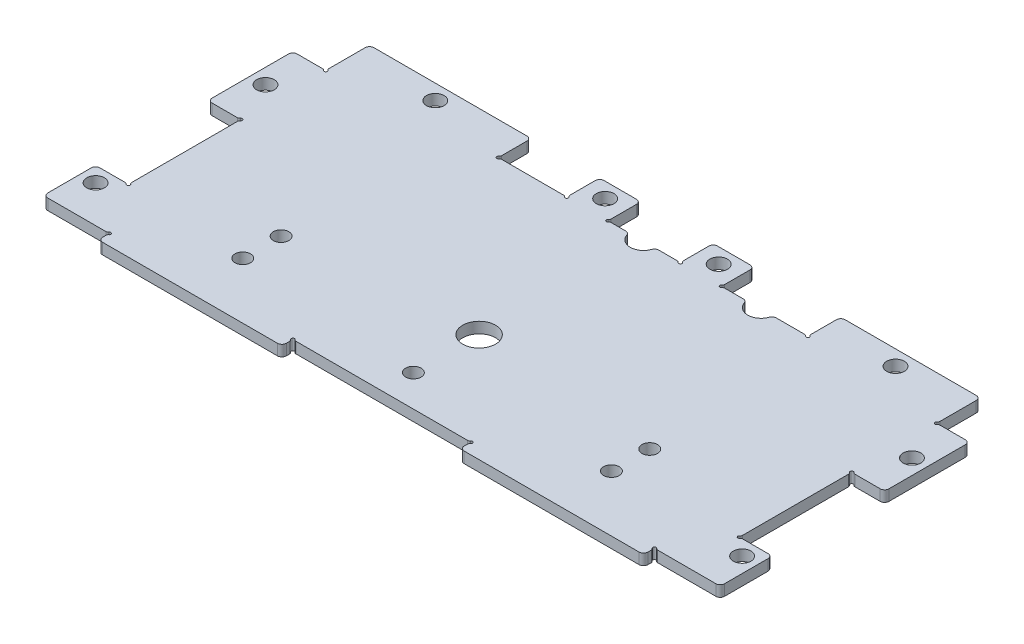
from build123d import *

# Parameters (mm, degrees)
STOCK_HAMMERSAW_START                   = 50.8
STOCK_HAMMERSAW_MULTIBODY_1_OUTLINE_R   = 2.5527
STOCK_HAMMERSAW_MULTIBODY_1_OUTLINE_R_2 = 2.2479
STOCK_HAMMERSAW_MULTIBODY_1_OUTLINE_R_3 = 4.7625
STOCK_HAMMERSAW_MULTIBODY_1_DEPTH       = 3.175
CUT_EXTRUDE1_DEPTH                      = 119.924837082
SKETCH2_R                               = 0.47625
CUT_EXTRUDE2_DEPTH                      = 119.395950087
FILLET1_R                               = 0.635
FILLET2_R                               = 1.27


# Read off the part's stored shape, not the designer's step: Stock-HammerSaw Multibody-1
with BuildPart() as part:
    # Stock-HammerSaw Multibody-1 outline → Stock-HammerSaw Multibody-1 (new body)
    with BuildSketch(Plane(origin=(0, 0, 0), x_dir=(1, 0, 0), z_dir=(0, 1, 0)).offset(STOCK_HAMMERSAW_START)):
        with BuildLine():
            Line((47.625, 57.15), (37.846, 57.15))
            ThreePointArc((37.846, 57.15), (34.036, 53.34), (30.226, 57.15))
            Line((30.226, 57.15), (23.368, 57.15))
            Line((23.368, 57.15), (23.368, 66.675))
            Line((23.368, 66.675), (10.668, 66.675))
            Line((10.668, 66.675), (10.668, 57.15))
            Line((10.668, 57.15), (3.81, 57.15))
            ThreePointArc((3.81, 57.15), (0, 53.34), (-3.81, 57.15))
            Line((-3.81, 57.15), (-9.525, 57.15))
            Line((-9.525, 57.15), (-9.525, 66.675))
            Line((-9.525, 66.675), (-22.225, 66.675))
            Line((-22.225, 66.675), (-22.225, 57.15))
            Line((-22.225, 57.15), (-41.275, 57.15))
            Line((-41.275, 57.15), (-41.275, 66.675))
            Line((-41.275, 66.675), (-88.9, 66.675))
            Line((-88.9, 66.675), (-88.9, 53.975))
            Line((-88.9, 53.975), (-98.425, 53.975))
            Line((-98.425, 53.975), (-98.425, 28.575))
            Line((-98.425, 28.575), (-88.9, 28.575))
            Line((-88.9, 28.575), (-88.9, -3.175))
            Line((-88.9, -3.175), (-98.425, -3.175))
            Line((-98.425, -3.175), (-98.425, -19.05))
            Line((-98.425, -19.05), (-79.375, -19.05))
            Line((-79.375, -19.05), (-79.375, -22.225))
            Line((-79.375, -22.225), (-25.4, -22.225))
            Line((-25.4, -22.225), (-25.4, -19.05))
            Line((-25.4, -19.05), (25.4, -19.05))
            Line((25.4, -19.05), (25.4, -22.225))
            Line((25.4, -22.225), (79.375, -22.225))
            Line((79.375, -22.225), (79.375, -19.05))
            Line((79.375, -19.05), (98.425, -19.05))
            Line((98.425, -19.05), (98.425, -3.175))
            Line((98.425, -3.175), (88.9, -3.175))
            Line((88.9, -3.175), (88.9, 28.575))
            Line((88.9, 28.575), (98.425, 28.575))
            Line((98.425, 28.575), (98.425, 53.975))
            Line((98.425, 53.975), (88.9, 53.975))
            Line((88.9, 53.975), (88.9, 66.675))
            Line((88.9, 66.675), (47.625, 66.675))
            Line((47.625, 66.675), (47.625, 57.15))
        make_face()
        with Locations((-93.6625, -7.9375)):
            Circle(STOCK_HAMMERSAW_MULTIBODY_1_OUTLINE_R, mode=Mode.SUBTRACT)
        with Locations((-53.4035, -5.55244)):
            Circle(STOCK_HAMMERSAW_MULTIBODY_1_OUTLINE_R_2, mode=Mode.SUBTRACT)
        with Locations((-53.4035, 5.55244)):
            Circle(STOCK_HAMMERSAW_MULTIBODY_1_OUTLINE_R_2, mode=Mode.SUBTRACT)
        with Locations((0, -9.525)):
            Circle(STOCK_HAMMERSAW_MULTIBODY_1_OUTLINE_R_2, mode=Mode.SUBTRACT)
        with Locations((53.4035, -5.55244)):
            Circle(STOCK_HAMMERSAW_MULTIBODY_1_OUTLINE_R_2, mode=Mode.SUBTRACT)
        with Locations((93.6625, -7.9375)):
            Circle(STOCK_HAMMERSAW_MULTIBODY_1_OUTLINE_R, mode=Mode.SUBTRACT)
        with Locations((0, 9.525)):
            Circle(STOCK_HAMMERSAW_MULTIBODY_1_OUTLINE_R_3, mode=Mode.SUBTRACT)
        with Locations((53.4035, 5.55244)):
            Circle(STOCK_HAMMERSAW_MULTIBODY_1_OUTLINE_R_2, mode=Mode.SUBTRACT)
        with Locations((-93.6625, 41.275)):
            Circle(STOCK_HAMMERSAW_MULTIBODY_1_OUTLINE_R, mode=Mode.SUBTRACT)
        with Locations((-65.0875, 61.9125)):
            Circle(STOCK_HAMMERSAW_MULTIBODY_1_OUTLINE_R, mode=Mode.SUBTRACT)
        with Locations((-15.875, 61.9125)):
            Circle(STOCK_HAMMERSAW_MULTIBODY_1_OUTLINE_R, mode=Mode.SUBTRACT)
        with Locations((93.6625, 41.275)):
            Circle(STOCK_HAMMERSAW_MULTIBODY_1_OUTLINE_R, mode=Mode.SUBTRACT)
        with Locations((17.018, 61.9125)):
            Circle(STOCK_HAMMERSAW_MULTIBODY_1_OUTLINE_R, mode=Mode.SUBTRACT)
        with Locations((68.2625, 61.9125)):
            Circle(STOCK_HAMMERSAW_MULTIBODY_1_OUTLINE_R, mode=Mode.SUBTRACT)
    extrude(amount=STOCK_HAMMERSAW_MULTIBODY_1_DEPTH)

    # Sketch1 → Cut-Extrude1 (cut, through all)
    with BuildSketch(Plane(origin=(0, 53.975, 0), x_dir=(1, 0, 0), z_dir=(0, 1, 0))):
        Polygon((88.9, 53.975), (88.9, 66.675), (47.625, 66.675), (47.625, 57.15), (37.846, 57.15), (30.226, 57.15), (23.368, 57.15), (23.368, 66.675), (10.668, 66.675), (10.668, 57.15), (3.81, 57.15), (-3.81, 57.15), (-9.525, 57.15), (-9.525, 66.675), (-22.225, 66.675), (-22.225, 57.15), (-41.275, 57.15), (-41.275, 66.675), (-88.9, 66.675), (-88.9, 53.975), (-98.425, 53.975), (-98.425, 28.575), (-88.9, 28.575), (-88.9, -3.175), (-98.425, -3.175), (-98.425, -19.05), (-79.375, -19.05), (-79.375, -22.225), (-25.4, -22.225), (-25.4, -19.05), (25.4, -19.05), (25.4, -22.225), (79.375, -22.225), (79.375, -19.05), (98.425, -19.05), (98.425, -3.175), (88.9, -3.175), (88.9, 28.575), (98.425, 28.575), (98.425, 53.975), align=None)
        Polygon((88.519, 53.594), (88.519, 66.294), (48.006, 66.294), (48.006, 56.769), (37.846, 56.769), (30.226, 56.769), (22.987, 56.769), (22.987, 66.294), (11.049, 66.294), (11.049, 56.769), (3.81, 56.769), (-3.81, 56.769), (-9.906, 56.769), (-9.906, 66.294), (-21.844, 66.294), (-21.844, 56.769), (-41.656, 56.769), (-41.656, 66.294), (-88.519, 66.294), (-88.519, 53.594), (-98.044, 53.594), (-98.044, 28.956), (-88.519, 28.956), (-88.519, -3.556), (-98.044, -3.556), (-98.044, -18.669), (-78.994, -18.669), (-78.994, -21.844), (-25.781, -21.844), (-25.781, -18.669), (25.781, -18.669), (25.781, -21.844), (78.994, -21.844), (78.994, -18.669), (98.044, -18.669), (98.044, -3.556), (88.519, -3.556), (88.519, 28.956), (98.044, 28.956), (98.044, 53.594), align=None, mode=Mode.SUBTRACT)
    extrude(amount=-CUT_EXTRUDE1_DEPTH, mode=Mode.SUBTRACT)

    # Sketch2 → Cut-Extrude2 (cut, through all)
    with BuildSketch(Plane(origin=(0, 53.975, 0), x_dir=(1, 0, 0), z_dir=(0, 1, 0))):
        with Locations((-88.519, 53.594)):
            Circle(SKETCH2_R)
        with Locations((-41.656, 56.769)):
            Circle(SKETCH2_R)
        with Locations((-21.844, 56.769)):
            Circle(SKETCH2_R)
        with Locations((-9.906, 56.769)):
            Circle(SKETCH2_R)
        with Locations((11.049, 56.769)):
            Circle(SKETCH2_R)
        with Locations((22.987, 56.769)):
            Circle(SKETCH2_R)
        with Locations((48.006, 56.769)):
            Circle(SKETCH2_R)
        with Locations((88.519, 53.594)):
            Circle(SKETCH2_R)
        with Locations((88.519, 28.956)):
            Circle(SKETCH2_R)
        with Locations((88.519, -3.556)):
            Circle(SKETCH2_R)
        with Locations((78.994, -18.669)):
            Circle(SKETCH2_R)
        with Locations((25.781, -18.669)):
            Circle(SKETCH2_R)
        with Locations((-25.781, -18.669)):
            Circle(SKETCH2_R)
        with Locations((-78.994, -18.669)):
            Circle(SKETCH2_R)
        with Locations((-88.519, -3.556)):
            Circle(SKETCH2_R)
        with Locations((-88.519, 28.956)):
            Circle(SKETCH2_R)
    extrude(amount=-CUT_EXTRUDE2_DEPTH, mode=Mode.SUBTRACT)

    # Fillet1
    fillet1_edges = [part.edges().sort_by_distance(p)[0] for p in [
        (22.987, 52.3875, -57.24525),
        (11.049, 52.3875, -57.24525),
        (88.99525, 52.3875, -53.594),
        (48.006, 52.3875, -57.24525),
        (88.99525, 52.3875, -28.956),
        (88.519, 52.3875, 3.07975),
        (79.47025, 52.3875, 18.669),
        (25.781, 52.3875, 19.14525),
        (-25.30475, 52.3875, 18.669),
        (-78.994, 52.3875, 19.14525),
        (-88.99525, 52.3875, 3.556),
        (-88.519, 52.3875, -28.47975),
        (-88.99525, 52.3875, -53.594),
        (-41.656, 52.3875, -57.24525),
        (-22.32025, 52.3875, -56.769),
        (-9.906, 52.3875, -57.24525),
        (-41.17975, 52.3875, -56.769),
        (-21.844, 52.3875, -57.24525),
        (-9.42975, 52.3875, -56.769),
        (10.57275, 52.3875, -56.769),
        (23.46325, 52.3875, -56.769),
        (47.52975, 52.3875, -56.769),
        (88.519, 52.3875, -54.07025),
        (88.519, 52.3875, -28.47975),
        (88.99525, 52.3875, 3.556),
        (78.994, 52.3875, 19.14525),
        (25.30475, 52.3875, 18.669),
        (-25.781, 52.3875, 19.14525),
        (-79.47025, 52.3875, 18.669),
        (-88.519, 52.3875, 3.07975),
        (-88.99525, 52.3875, -28.956),
        (-88.519, 52.3875, -54.07025),
    ]]
    fillet(fillet1_edges, radius=FILLET1_R)

    # Fillet2
    fillet2_edges = [part.edges().sort_by_distance(p)[0] for p in [
        (37.826902135, 52.3875, -56.769),
        (30.245097865, 52.3875, -56.769),
        (3.790902135, 52.3875, -56.769),
        (-3.790902135, 52.3875, -56.769),
        (98.044, 52.3875, -53.594),
        (98.044, 52.3875, -28.956),
        (98.044, 52.3875, 3.556),
        (98.044, 52.3875, 18.669),
        (78.994, 52.3875, 21.844),
        (25.781, 52.3875, 21.844),
        (-25.781, 52.3875, 21.844),
        (-78.994, 52.3875, 21.844),
        (-98.044, 52.3875, 18.669),
        (-98.044, 52.3875, 3.556),
        (-98.044, 52.3875, -28.956),
        (-98.044, 52.3875, -53.594),
        (-88.519, 52.3875, -66.294),
        (-41.656, 52.3875, -66.294),
        (-21.844, 52.3875, -66.294),
        (-9.906, 52.3875, -66.294),
        (11.049, 52.3875, -66.294),
        (22.987, 52.3875, -66.294),
        (48.006, 52.3875, -66.294),
        (88.519, 52.3875, -66.294),
    ]]
    fillet(fillet2_edges, radius=FILLET2_R)


solid = part.part
